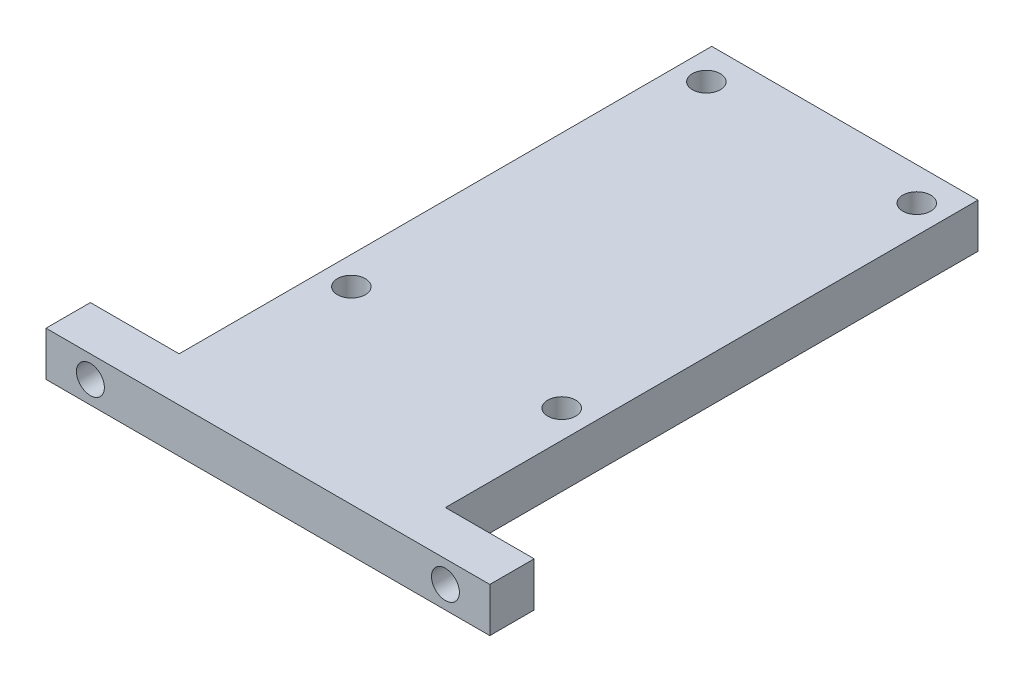
from build123d import *

# Parameters (mm, degrees)
BOSS_EXTRUDE1_DEPTH     = 6.35
CUT_EXTRUDE1_DEPTH      = 105.341147205
CUT_EXTRUDE1_DEPTH_BACK = 105.341147205
SKETCH2_R               = 2
CUT_EXTRUDE2_DEPTH      = 105.341147205
CUT_EXTRUDE2_DEPTH_BACK = 105.341147205
SKETCH3_R               = 2


with BuildPart() as part:
    # Sketch1 → Boss-Extrude1 (new body)
    with BuildSketch(Plane(origin=(0, 0, 0), x_dir=(1, 0, 0), z_dir=(0, 1, 0))):
        Polygon((0, 0), (63.5, 0), (63.5, 6.35), (50.8, 6.35), (50.8, 82.55), (12.7, 82.55), (12.7, 6.35), (0, 6.35), align=None)
    extrude(amount=BOSS_EXTRUDE1_DEPTH)

    # Sketch2 → Cut-Extrude1 (cut, two sides: drawn at the far end of the back side and taken through both)
    with BuildSketch(Plane.XY.offset(-CUT_EXTRUDE1_DEPTH_BACK)):
        with Locations((6.35, 3.175)):
            Circle(SKETCH2_R)
        with Locations((57.15, 3.175)):
            Circle(SKETCH2_R)
    extrude(amount=CUT_EXTRUDE1_DEPTH + CUT_EXTRUDE1_DEPTH_BACK, mode=Mode.SUBTRACT)

    # Sketch3 → Cut-Extrude2 (cut, two sides: drawn at the far end of the back side and taken through both)
    with BuildSketch(Plane(origin=(0, 6.35, 0), x_dir=(1, 0, 0), z_dir=(0, 1, 0)).offset(-CUT_EXTRUDE2_DEPTH_BACK)):
        with Locations((46.8, 77.7875)):
            Circle(SKETCH3_R)
        with Locations((16.7, 77.7875)):
            Circle(SKETCH3_R)
        with Locations((16.7, 26.9875)):
            Circle(SKETCH3_R)
        with Locations((46.8, 26.9875)):
            Circle(SKETCH3_R)
    extrude(amount=CUT_EXTRUDE2_DEPTH + CUT_EXTRUDE2_DEPTH_BACK, mode=Mode.SUBTRACT)


solid = part.part
